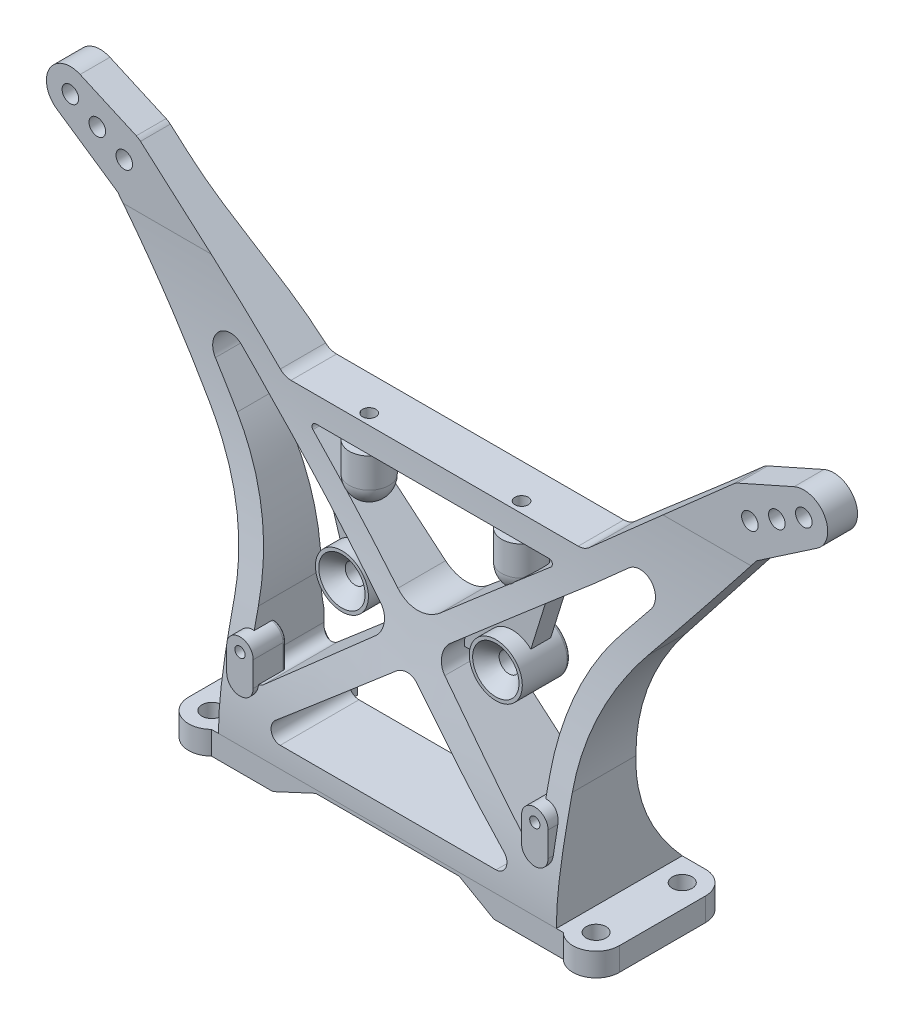
from build123d import *

# Parameters (mm, degrees)
BOSS_EXTRUDE2_DEPTH      = 8.5
BOSS_EXTRUDE2_DEPTH_BACK = 11.5
SKETCH3_R                = 1.25
CUT_EXTRUDE1_DEPTH       = 71.236974311
CUT_EXTRUDE1_DEPTH_BACK  = 71.236974311
SKETCH5_R                = 1.5
CUT_EXTRUDE2_DEPTH       = 94.769539314
BOSS_EXTRUDE3_START      = 2
BOSS_EXTRUDE3_DEPTH      = 2
CUT_EXTRUDE3_DEPTH       = 471.249700979
SKETCH11_R               = 1
CUT_EXTRUDE4_DEPTH       = 8
BOSS_EXTRUDE5_DEPTH      = 1.5
BOSS_EXTRUDE5_DEPTH_BACK = 1.5
BOSS_EXTRUDE6_START      = -4.75
SKETCH14_R               = 4
BOSS_EXTRUDE6_DEPTH      = 7.25
SKETCH15_R               = 1.5
CUT_EXTRUDE5_DEPTH       = 71.739275236
CHAMFER1_SIZE            = 2
FILLET1_R                = 0.5
BOSS_EXTRUDE7_DEPTH      = 5
FILLET2_R                = 0.5
SKETCH17_R               = 0.77074254
CUT_EXTRUDE6_DEPTH       = 4
FILLET2_OF_MIRROR5_R     = 0.5


with BuildPart() as part:
    # Sketch3 → Boss-Extrude2 (new, two sides: drawn at the far end of the back side and taken through both)
    with BuildSketch(Plane.XY.offset(-BOSS_EXTRUDE2_DEPTH_BACK)):
        with BuildLine():
            Line((16.056715285, -35.606235914), (32.5, -35.606235914))
            Line((32.5, -35.606235914), (32.5, -32.106235914))
            Line((32.5, -32.106235914), (25.5, -32.106235914))
            Line((25.5, -32.106235914), (25.5, -15.522610817))
            add(Edge.make_bspline(
                [(25.5, -15.522610817), (25.5, -7.952822435), (28.645108641, -1.394452749), (33.063516259, 4.238884486)],
                knots=[0, 0, 0, 0, 1, 1, 1, 1], degree=3))
            Line((33.063516259, 4.238884486), (48.211330786, 23.551893824))
            Line((48.211330786, 23.551893824), (57.380925552, 29.792031973))
            ThreePointArc((57.380925552, 29.792031973), (58.505178237, 34.537916534), (53.878743359, 36.081763898))
            Line((53.878743359, 36.081763898), (45.399206212, 32.309501221))
            ThreePointArc((45.399206212, 32.309501221), (45.065395351, 32.129517179), (44.762649592, 31.901111945))
            Line((44.762649592, 31.901111945), (23.330776047, 13.017982489))
            ThreePointArc((23.330776047, 13.017982489), (22.561398778, 12.555019338), (21.678068147, 12.393764086))
            Line((21.678068147, 12.393764086), (-21.678068147, 12.393764086))
            ThreePointArc((-21.678068147, 12.393764086), (-22.561398778, 12.555019338), (-23.330776047, 13.017982489))
            Line((-23.330776047, 13.017982489), (-44.762649592, 31.901111945))
            ThreePointArc((-44.762649592, 31.901111945), (-45.065395351, 32.129517179), (-45.399206212, 32.309501221))
            Line((-45.399206212, 32.309501221), (-53.878743359, 36.081763898))
            ThreePointArc((-53.878743359, 36.081763898), (-58.505178237, 34.537916534), (-57.380925552, 29.792031973))
            Line((-57.380925552, 29.792031973), (-48.211330786, 23.551893824))
            Line((-48.211330786, 23.551893824), (-33.063516259, 4.238884486))
            add(Edge.make_bspline(
                [(-25.5, -15.522610817), (-25.5, -7.952822435), (-28.645108641, -1.394452749), (-33.063516259, 4.238884486)],
                knots=[0, 0, 0, 0, 1, 1, 1, 1], degree=3))
            Line((-25.5, -15.522610817), (-25.5, -32.106235914))
            Line((-25.5, -32.106235914), (-32.5, -32.106235914))
            Line((-32.5, -32.106235914), (-32.5, -35.606235914))
            Line((-32.5, -35.606235914), (-17.27596614, -35.606235914))
            Line((-17.27596614, -35.606235914), (-10.829498936, -32.606235914))
            Line((-10.829498936, -32.606235914), (10.829498936, -32.606235914))
            Line((10.829498936, -32.606235914), (16.056715285, -35.606235914))
        make_face()
        with BuildLine():
            ThreePointArc((-5.2406262, -7.099865833), (-4.350298014, -9.001413979), (-5.223379625, -10.910942228))
            Line((-5.223379625, -10.910942228), (-19.523864326, -23.167381334))
            ThreePointArc((-19.523864326, -23.167381334), (-21.126815957, -23.391207595), (-22, -22.028452388))
            Line((-22, -22.028452388), (-22, -14.97801543))
            add(Edge.make_bspline(
                [(-22, -14.97801543), (-22, -7.351549828), (-24.58676482, -0.689880983), (-29.018394844, 4.960314423)],
                knots=[0, 0, 0, 0, 1, 1, 1, 1], degree=3))
            Line((-29.018394844, 4.960314423), (-32.871369241, 9.872741254))
            ThreePointArc((-32.871369241, 9.872741254), (-32.620349328, 13.23912629), (-29.245122483, 13.297461135))
            Line((-29.245122483, 13.297461135), (-24.247037895, 8.893764086))
            Line((-24.247037895, 8.893764086), (-5.2406262, -7.099865833))
        make_face(mode=Mode.SUBTRACT)
        with BuildLine():
            Line((16.289021977, -29.106235914), (-16.289021977, -29.106235914))
            ThreePointArc((-16.289021977, -29.106235914), (-17.699882945, -28.1156192), (-17.247247304, -26.452197689))
            Line((-17.247247304, -26.452197689), (-1.59704221, -13.457460981))
            ThreePointArc((-1.59704221, -13.457460981), (0, -12.880858022), (1.59704221, -13.457460981))
            Line((1.59704221, -13.457460981), (17.247247304, -26.452197689))
            ThreePointArc((17.247247304, -26.452197689), (17.699882945, -28.1156192), (16.289021977, -29.106235914))
        make_face(mode=Mode.SUBTRACT)
        with BuildLine():
            Line((5.2406262, -7.099865833), (24.247037895, 8.893764086))
            Line((24.247037895, 8.893764086), (29.245122483, 13.297461135))
            ThreePointArc((29.245122483, 13.297461135), (32.620349328, 13.23912629), (32.871369241, 9.872741254))
            Line((32.871369241, 9.872741254), (29.018394844, 4.960314423))
            add(Edge.make_bspline(
                [(22, -14.97801543), (22, -7.351549828), (24.58676482, -0.689880983), (29.018394844, 4.960314423)],
                knots=[0, 0, 0, 0, 1, 1, 1, 1], degree=3))
            Line((22, -14.97801543), (22, -22.028452388))
            ThreePointArc((22, -22.028452388), (21.126815957, -23.391207595), (19.523864326, -23.167381334))
            Line((19.523864326, -23.167381334), (5.223379625, -10.910942228))
            ThreePointArc((5.223379625, -10.910942228), (4.350298014, -9.001413979), (5.2406262, -7.099865833))
        make_face(mode=Mode.SUBTRACT)
        with Locations((-47.212916419, 28.272680353)):
            Circle(SKETCH3_R, mode=Mode.SUBTRACT)
        with Locations((-51.280298389, 30.52623611)):
            Circle(SKETCH3_R, mode=Mode.SUBTRACT)
        with Locations((-55.347680358, 32.779791867)):
            Circle(SKETCH3_R, mode=Mode.SUBTRACT)
        with BuildLine():
            ThreePointArc((-17.95758585, 8.011191789), (-18.105383202, 8.565102715), (-17.635656607, 8.893764086))
            Line((-17.635656607, 8.893764086), (17.635656607, 8.893764086))
            ThreePointArc((17.635656607, 8.893764086), (18.105383202, 8.565102715), (17.95758585, 8.011191789))
            Line((17.95758585, 8.011191789), (3.219292432, -4.390876225))
            ThreePointArc((3.219292432, -4.390876225), (0, -5.565153256), (-3.219292432, -4.390876225))
            Line((-3.219292432, -4.390876225), (-17.95758585, 8.011191789))
        make_face(mode=Mode.SUBTRACT)
        with Locations((47.212916419, 28.272680353)):
            Circle(SKETCH3_R, mode=Mode.SUBTRACT)
        with Locations((51.280298389, 30.52623611)):
            Circle(SKETCH3_R, mode=Mode.SUBTRACT)
        with Locations((55.347680358, 32.779791867)):
            Circle(SKETCH3_R, mode=Mode.SUBTRACT)
    extrude(amount=BOSS_EXTRUDE2_DEPTH + BOSS_EXTRUDE2_DEPTH_BACK)

    # Sketch4 → Cut-Extrude1 (cut, two sides: drawn at the far end of the back side and taken through both)
    with BuildSketch(Plane(origin=(0, 0, 0), x_dir=(0, 0, -1), z_dir=(1, 0, 0)).offset(-CUT_EXTRUDE1_DEPTH_BACK)):
        with BuildLine():
            Line((-8.5, 36.393764086), (-8.5, -32.106235914))
            Line((-8.5, -32.106235914), (-7.5, -32.106235914))
            add(Edge.make_bspline(
                [(-7.5, -32.106235914), (-7.5, -18.237754328), (0, -3.862875074), (0, 22.495726475)],
                knots=[0, 0, 0, 0, 1, 1, 1, 1], degree=3))
            Line((0, 22.495726475), (0, 36.393764086))
            Line((0, 36.393764086), (-8.5, 36.393764086))
        make_face()
        with BuildLine():
            Line((11.5, 36.393764086), (4.5, 36.393764086))
            Line((4.5, 36.393764086), (4.5, -16.194195212))
            add(Edge.make_bspline(
                [(4.5, -16.194195212), (4.5, -24.384335502), (11.5, -32.106235914)],
                knots=[0, 0, 0, 1, 1, 1], degree=2))
            Line((11.5, -32.106235914), (11.5, 36.393764086))
        make_face()
    extrude(amount=CUT_EXTRUDE1_DEPTH + CUT_EXTRUDE1_DEPTH_BACK, mode=Mode.SUBTRACT)

    # Sketch5 → Cut-Extrude2 (cut, through all)
    with BuildSketch(Plane.XZ.offset(35.606235914)):
        with BuildLine():
            Line((20.5, -4.5), (16.056715285, -4.5))
            Line((16.056715285, -4.5), (16.056715285, -11.5))
            Line((16.056715285, -11.5), (23.5, -11.5))
            Line((23.5, -11.5), (23.5, -7.5))
            ThreePointArc((23.5, -7.5), (22.621320344, -5.378679656), (20.5, -4.5))
        make_face()
        with BuildLine():
            Line((16.056715285, -11.5), (16.056715285, -4.5))
            Line((16.056715285, -4.5), (9.328427125, -4.5))
            Line((9.328427125, -4.5), (-9.328427125, -4.5))
            Line((-9.328427125, -4.5), (-20.5, -4.5))
            ThreePointArc((-20.5, -4.5), (-22.621320344, -5.378679656), (-23.5, -7.5))
            Line((-23.5, -7.5), (-23.5, -11.5))
            Line((-23.5, -11.5), (16.056715285, -11.5))
        make_face()
        with Locations(Location((29, -8, 0), (0, 0, 270))):
            Circle(SKETCH5_R)
        with BuildLine():
            Line((32.5, -11.5), (32.5, -8))
            ThreePointArc((32.5, -8), (31.474873734, -10.474873734), (29, -11.5))
            Line((29, -11.5), (32.5, -11.5))
        make_face()
        with BuildLine():
            Line((32.5, 8.5), (29, 8.5))
            ThreePointArc((29, 8.5), (31.474873734, 7.474873734), (32.5, 5))
            Line((32.5, 5), (32.5, 8.5))
        make_face()
        with Locations(Location((29, 5, 0), (0, 0, 270))):
            Circle(SKETCH5_R)
        with BuildLine():
            Line((16.056715285, 7.5), (26.550510257, 7.5))
            ThreePointArc((26.550510257, 7.5), (27.677124344, 8.240370349), (29, 8.5))
            Line((29, 8.5), (16.056715285, 8.5))
            Line((16.056715285, 8.5), (16.056715285, 7.5))
        make_face()
        with BuildLine():
            Line((-26.550510257, 7.5), (16.056715285, 7.5))
            Line((16.056715285, 7.5), (16.056715285, 8.5))
            Line((16.056715285, 8.5), (-29, 8.5))
            ThreePointArc((-29, 8.5), (-27.677124344, 8.240370349), (-26.550510257, 7.5))
        make_face()
        with BuildLine():
            Line((-32.5, 5), (-32.5, 8.5))
            Line((-32.5, 8.5), (-29, 8.5))
            ThreePointArc((-29, 8.5), (-31.474873734, 7.474873734), (-32.5, 5))
        make_face()
        with Locations(Location((-29, 5, 0), (0, 0, 270))):
            Circle(SKETCH5_R)
        with Locations(Location((-29, -8, 0), (0, 0, 270))):
            Circle(SKETCH5_R)
        with BuildLine():
            ThreePointArc((-32.5, -8), (-31.474873734, -10.474873734), (-29, -11.5))
            Line((-29, -11.5), (-32.5, -11.5))
            Line((-32.5, -11.5), (-32.5, -8))
        make_face()
    extrude(amount=-CUT_EXTRUDE2_DEPTH, mode=Mode.SUBTRACT)

    # Sketch7 → Boss-Extrude3 (add)
    with BuildSketch(Plane(origin=(0, 0, -4.5), x_dir=(-1, 0, 0), z_dir=(0, 0, -1)).offset(BOSS_EXTRUDE3_START)):
        with BuildLine():
            Line((21.678068147, 12.393764086), (-21.678068147, 12.393764086))
            ThreePointArc((-21.678068147, 12.393764086), (-22.561398778, 12.555019338), (-23.330776047, 13.017982489))
            Line((-23.330776047, 13.017982489), (-42.088592012, 29.545061488))
            Line((-42.088592012, 29.545061488), (-44.534717687, 26.768770816))
            Line((-44.534717687, 26.768770816), (-29.245122483, 13.297461135))
            Line((-29.245122483, 13.297461135), (-25.663982043, 10.142200893))
            ThreePointArc((-25.663982043, 10.142200893), (-24.125227506, 9.21627459), (-22.358566244, 8.893764086))
            Line((-22.358566244, 8.893764086), (-17.635656607, 8.893764086))
            Line((-17.635656607, 8.893764086), (17.635656607, 8.893764086))
            Line((17.635656607, 8.893764086), (22.358566244, 8.893764086))
            ThreePointArc((22.358566244, 8.893764086), (24.125227506, 9.21627459), (25.663982043, 10.142200893))
            Line((25.663982043, 10.142200893), (29.245122483, 13.297461135))
            Line((29.245122483, 13.297461135), (44.534717687, 26.768770816))
            Line((44.534717687, 26.768770816), (42.088592012, 29.545061488))
            Line((42.088592012, 29.545061488), (23.330776047, 13.017982489))
            ThreePointArc((23.330776047, 13.017982489), (22.561398778, 12.555019338), (21.678068147, 12.393764086))
        make_face()
    extrude(amount=-BOSS_EXTRUDE3_DEPTH)

    # Sketch8 → Cut-Extrude3 (cut)
    with BuildSketch(Plane(origin=(3.73910378, -4.243788064, 0), x_dir=(0.750312638596334, 0.6610831599448038, 0), z_dir=(-0.6610831599448038, 0.750312638596334, 0))):
        with BuildLine():
            Line((26.111345136, 6.5), (51.111345136, 6.5))
            Line((51.111345136, 6.5), (51.111345136, 4.5))
            add(Edge.make_bspline(
                [(26.111345136, 6.5), (34.524382368, 6.5), (42.751387667, 4.5), (51.111345136, 4.5)],
                knots=[0, 0, 0, 0, 1, 1, 1, 1], degree=3))
        make_face()
    cut_extrude3 = extrude(amount=-CUT_EXTRUDE3_DEPTH, mode=Mode.SUBTRACT)

    # Mirror1: Cut-Extrude3 across plane
    add(cut_extrude3.mirror(Plane(origin=(0, 0, 0), x_dir=(0, 0, 1), z_dir=(1, 0, 0))), mode=Mode.SUBTRACT)

    # Sketch10 → Revolve1 (revolve)
    with BuildSketch(Plane.XY.offset(-1.25), mode=Mode.PRIVATE) as revolve1_sk:
        with BuildLine():
            Line((-11.5, 8.893764086), (-11.5, 1.42649889))
            ThreePointArc((-11.5, 1.42649889), (-9.378679656, 2.305178546), (-8.5, 4.42649889))
            Line((-8.5, 4.42649889), (-8.5, 8.893764086))
            Line((-8.5, 8.893764086), (-11.5, 8.893764086))
        make_face()
    revolve1 = revolve(revolve1_sk.sketch.rotate(Axis((-11.5, 8.893764086, -1.25), (0, -1, 0)), 139.749341331), axis=Axis((-11.5, 8.893764086, -1.25), (0, -1, 0)))

    # Mirror3: Revolve1 across plane
    add(revolve1.mirror(Plane(origin=(0, 0, 0), x_dir=(0, 0, 1), z_dir=(1, 0, 0))))

    # Sketch11 → Cut-Extrude4 (cut)
    with BuildSketch(Plane(origin=(0, 12.393764086, 0), x_dir=(1, 0, 0), z_dir=(0, 1, 0))):
        with Locations(Location((-11.5, 1.25, 0), (0, 0, 270))):
            Circle(SKETCH11_R)
        with Locations(Location((11.5, 1.25, 0), (0, 0, 270))):
            Circle(SKETCH11_R)
    extrude(amount=-CUT_EXTRUDE4_DEPTH, mode=Mode.SUBTRACT)

    # Sketch13 → Boss-Extrude5 (add, two sides: drawn at the far end of the back side and taken through both)
    with BuildSketch(Plane.XY.offset(-1.25).offset(-BOSS_EXTRUDE5_DEPTH_BACK)):
        with BuildLine():
            ThreePointArc((5.2406262, -7.099865833), (4.508655628, -8.137038549), (4.380450586, -9.4))
            Line((4.380450586, -9.4), (12.966979328, -9.4))
            Line((12.966979328, -9.4), (16.661000384, 2.510219498))
            Line((16.661000384, 2.510219498), (5.2406262, -7.099865833))
        make_face()
        with BuildLine():
            Line((-5.2406262, -7.099865833), (-16.661000384, 2.510219498))
            Line((-16.661000384, 2.510219498), (-12.966979328, -9.4))
            Line((-12.966979328, -9.4), (-4.380450586, -9.4))
            ThreePointArc((-4.380450586, -9.4), (-4.508655628, -8.137038549), (-5.2406262, -7.099865833))
        make_face()
    extrude(amount=BOSS_EXTRUDE5_DEPTH + BOSS_EXTRUDE5_DEPTH_BACK)

    # Sketch14 → Boss-Extrude6 (add)
    with BuildSketch(Plane.XY.offset(0.25).offset(BOSS_EXTRUDE6_START)):
        with Locations((-11.614027349, -7.651543521)):
            Circle(SKETCH14_R)
        with Locations((11.614027349, -7.651543521)):
            Circle(SKETCH14_R)
    extrude(amount=BOSS_EXTRUDE6_DEPTH)

    # Sketch15 → Cut-Extrude5 (cut, through all)
    with BuildSketch(Plane.XY.offset(2.75)):
        with Locations((-11.614027349, -7.651543521)):
            Circle(SKETCH15_R)
        with Locations((11.614027349, -7.651543521)):
            Circle(SKETCH15_R)
    extrude(amount=-CUT_EXTRUDE5_DEPTH, mode=Mode.SUBTRACT)

    # Chamfer1
    chamfer1_edges = [part.edges().sort_by_distance(p)[0] for p in [
        (-13.114027349, -7.651543521, 2.75),
        (10.114027349, -7.651543521, 2.75),
    ]]
    chamfer(chamfer1_edges, length=CHAMFER1_SIZE)

    # Fillet1
    fillet1_edges = [part.edges().sort_by_distance(p)[0] for p in [
        (-15.614027349, -7.651543521, -4.5),
        (7.614027349, -7.651543521, -4.5),
    ]]
    fillet(fillet1_edges, radius=FILLET1_R)

    # Sketch16 → Boss-Extrude7 (add)
    with BuildSketch(Plane.XY.offset(7.5)):
        with BuildLine():
            Line((-20.25, -19.856235914), (-20.25, -23.606235914))
            ThreePointArc((-20.25, -23.606235914), (-22.25, -25.606235914), (-24.25, -23.606235914))
            Line((-24.25, -23.606235914), (-24.25, -19.856235914))
            ThreePointArc((-24.25, -19.856235914), (-22.25, -17.856235914), (-20.25, -19.856235914))
        make_face()
    boss_extrude7 = extrude(amount=-BOSS_EXTRUDE7_DEPTH)

    # Fillet2
    fillet2_edges = [part.edges().sort_by_distance(p)[0] for p in [
        (-20.75, -18.533360259, 2.5),
        (-20.25, -21.681854124, 2.5),
    ]]
    fillet(fillet2_edges, radius=FILLET2_R)

    # Sketch17 → Cut-Extrude6 (cut)
    with BuildSketch(Plane.XY.offset(7.5)):
        with Locations((-22.25, -19.856235914)):
            Circle(SKETCH17_R)
    cut_extrude6 = extrude(amount=-CUT_EXTRUDE6_DEPTH, mode=Mode.SUBTRACT)

    # Mirror5: Boss-Extrude7, Cut-Extrude6 across plane
    add(boss_extrude7.mirror(Plane(origin=(0, 0, 0), x_dir=(0, 0, 1), z_dir=(1, 0, 0))))
    add(cut_extrude6.mirror(Plane(origin=(0, 0, 0), x_dir=(0, 0, 1), z_dir=(1, 0, 0))), mode=Mode.SUBTRACT)

    # Fillet2 of Mirror5
    fillet2_of_mirror5_edges = [part.edges().sort_by_distance(p)[0] for p in [
        (20.75, -18.533360259, 2.5),
        (20.25, -21.681854124, 2.5),
    ]]
    fillet(fillet2_of_mirror5_edges, radius=FILLET2_OF_MIRROR5_R)


solid = part.part
